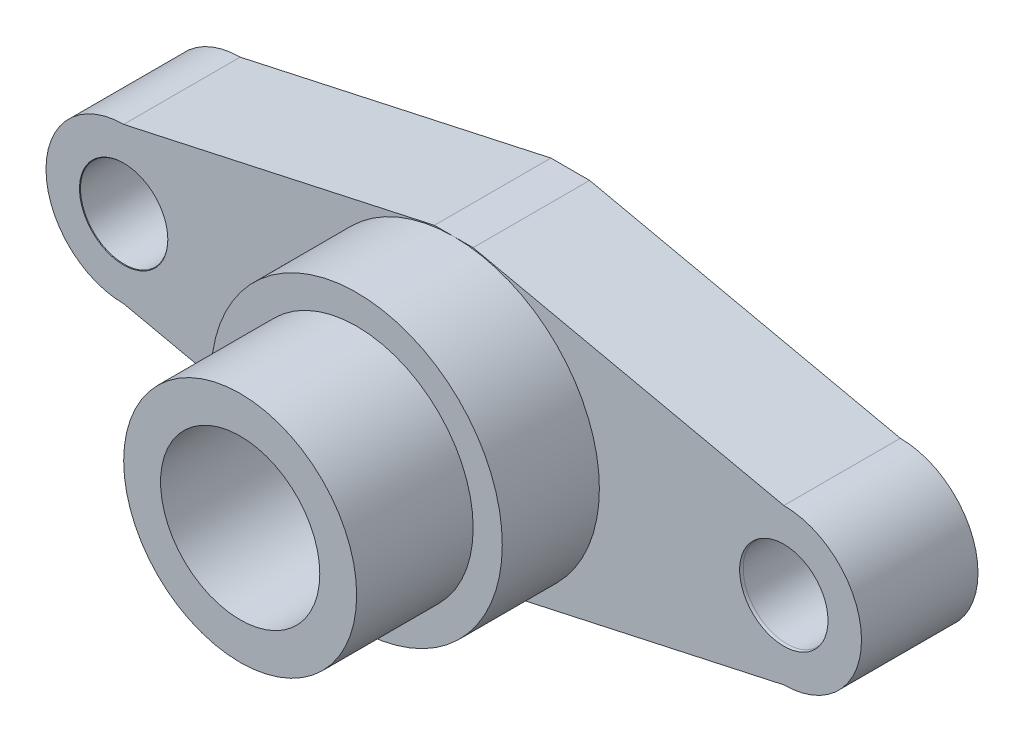
from build123d import *

# Parameters (mm, degrees)
BOSS_EXTRUDE1_DEPTH            = 6
BOSS_EXTRUDE2_DEPTH            = 5
BOSS_EXTRUDE2_DEPTH_BACK       = 6
SKETCH2_R                      = 7.5
SKETCH3_R                      = 6
BOSS_EXTRUDE3_DEPTH            = 6
SKETCH4_R                      = 4.1
CUT_EXTRUDE1_DEPTH             = 14
M4_CLEARANCE_HOLE1_D           = 4.5
M4_CLEARANCE_HOLE1_CSINK_D     = 4.55
M4_CLEARANCE_HOLE1_CSINK_ANGLE = 90
FILLET4_R                      = 0.5


with BuildPart() as part:
    # Sketch1 → Boss-Extrude1 (new body)
    with BuildSketch(Plane.XY):
        with BuildLine():
            Line((17, 4), (0.996565203, 7.5))
            Line((0.996565203, 7.5), (-0.996565203, 7.5))
            Line((-0.996565203, 7.5), (-17, 4))
            ThreePointArc((-17, 4), (-21, 0), (-17, -4))
            Line((-17, -4), (-0.996565203, -7.5))
            Line((-0.996565203, -7.5), (0.996565203, -7.5))
            Line((0.996565203, -7.5), (17, -4))
            ThreePointArc((17, -4), (21, 0), (17, 4))
        make_face()
    extrude(amount=BOSS_EXTRUDE1_DEPTH)

    # Sketch2 → Boss-Extrude2 (add, two sides: drawn at the far end of the back side and taken through both)
    with BuildSketch(Plane.XY.offset(6).offset(-BOSS_EXTRUDE2_DEPTH_BACK)):
        Circle(SKETCH2_R)
    extrude(amount=BOSS_EXTRUDE2_DEPTH + BOSS_EXTRUDE2_DEPTH_BACK)

    # Sketch3 → Boss-Extrude3 (add)
    with BuildSketch(Plane.XY.offset(11)):
        Circle(SKETCH3_R)
    extrude(amount=BOSS_EXTRUDE3_DEPTH)

    # Sketch4 → Cut-Extrude1 (cut)
    with BuildSketch(Plane.XY.offset(17)):
        Circle(SKETCH4_R)
    extrude(amount=-CUT_EXTRUDE1_DEPTH, mode=Mode.SUBTRACT)

    # M4 Clearance Hole1 (through all)
    with Locations(Plane(origin=(17, 0, 6), x_dir=(1, 0, 0), z_dir=(0, 0, 1))):
        with Locations((0, 0), (-34, 0)):
            CounterSinkHole(M4_CLEARANCE_HOLE1_D / 2, M4_CLEARANCE_HOLE1_CSINK_D / 2, counter_sink_angle=M4_CLEARANCE_HOLE1_CSINK_ANGLE)

    # Fillet4
    # the kernel refuses this fillet: 0.5 mm, written as the material it takes off along each edge
    with BuildSketch(Plane(origin=(17, 0, 5.975), x_dir=(-1, 0, 0), z_dir=(0, -1, 0))) as fillet4_piece_1:
        with BuildLine():
            CenterArc((2.75, 0.13112495), FILLET4_R, 180, 18.194872339)
            Line((2.25, 0.13112495), (2.24, 0.13112495))
            Line((2.24, 0.13112495), (2.24, 0))
            Line((2.24, 0), (2.242928932, -0.007071068))
            ThreePointArc((2.242928932, -0.007071068), (2.255428932, -0.019571068), (2.2655, -0.028122499))
            Line((2.2655, -0.028122499), (2.275, -0.025))
        make_face()
    revolve(axis=Axis((17, 0, 5.975), (0, 0, -1)), mode=Mode.SUBTRACT)


solid = part.part
